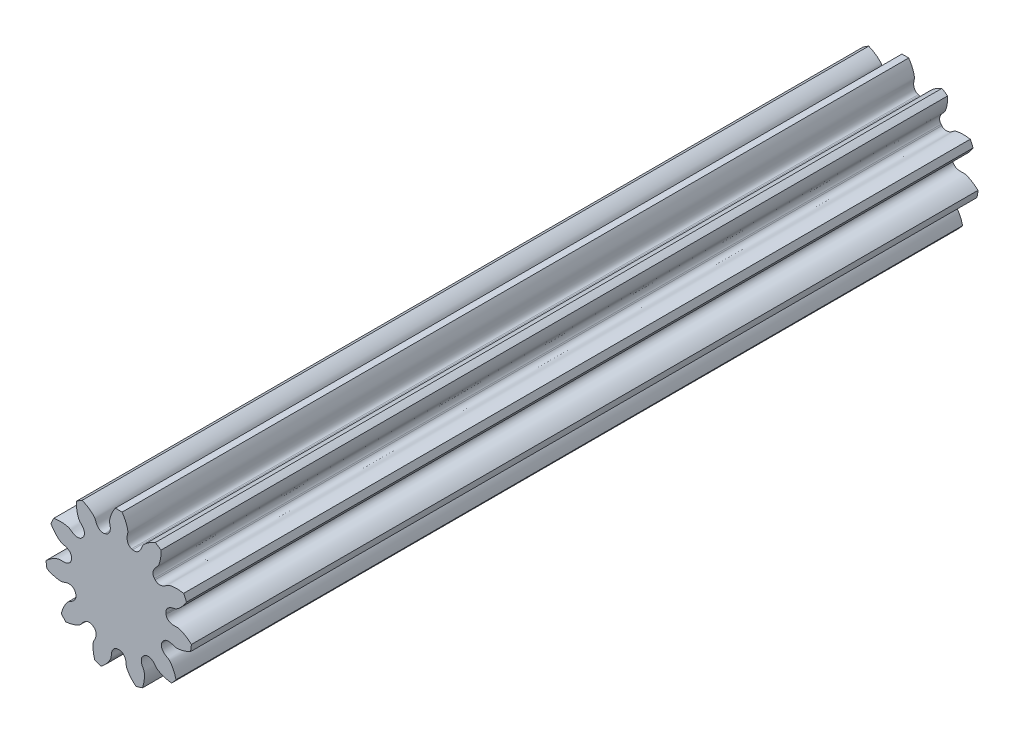
from build123d import *

# Parameters (mm, degrees)
EXTRUDE_1_DEPTH = 70


with BuildPart() as part:
    # Эскиз1 → Бобышка-Вытянуть1 (new body)
    with BuildSketch(Plane.XY):
        with BuildLine():
            ThreePointArc((0.303, 6.493), (0, 6.500066), (-0.303, 6.493))
            add(Edge.make_bspline(
                [(-0.303, 6.493), (-0.346584218, 6.42959541), (-0.414908989, 6.322872217), (-0.503832534, 6.171085791), (-0.571642486, 6.040604913), (-0.631254096, 5.909462755), (-0.68518257, 5.779105167), (-0.72964324, 5.648408312), (-0.767399302, 5.518328721), (-0.797951002, 5.37284466), (-0.827792109, 5.196066136), (-0.768218484, 4.972302757), (-0.736721493, 4.755594452), (-0.753966504, 4.568401559), (-0.785235089, 4.447093131), (-0.829023332, 4.351746005), (-0.87759341, 4.275547448), (-0.932758863, 4.214584459), (-1.017734715, 4.14379099), (-1.09368593, 4.106410336), (-1.15, 4.092)],
                knots=[0, 0, 0, 0, 0.085617132, 0.140969585, 0.1957209, 0.24916994, 0.301247193, 0.352628837, 0.402767547, 0.451734397, 0.518547692, 0.59904648, 0.705842174, 0.760987907, 0.80705749, 0.844573024, 0.877292442, 0.9072362, 0.935685939, 1, 1, 1, 1], degree=3))
            ThreePointArc((-1.15, 4.092), (-1.197511317, 4.07834901), (-1.244860662, 4.064146396))
            add(Edge.make_bspline(
                [(-3.255481007, 5.626073356), (-3.184536521, 5.596297428), (-3.069359152, 5.543455325), (-2.912489968, 5.463840156), (-2.784901317, 5.390733484), (-2.663852036, 5.31263815), (-2.548007884, 5.232130303), (-2.439945133, 5.146218365), (-2.337856377, 5.057200918), (-2.23350003, 4.951329433), (-2.112822407, 4.818747197), (-2.041963313, 4.59829753), (-1.951298913, 4.398962343), (-1.835587368, 4.250809018), (-1.743698272, 4.165662948), (-1.655312711, 4.109125552), (-1.573256911, 4.071282214), (-1.493889699, 4.04982158), (-1.384129623, 4.036207738), (-1.300025889, 4.045823457), (-1.244860662, 4.064146396)],
                knots=[0, 0, 0, 0, 0.085617132, 0.140969585, 0.1957209, 0.24916994, 0.301247193, 0.352628837, 0.402767547, 0.451734397, 0.518547692, 0.59904648, 0.705842174, 0.760987907, 0.80705749, 0.844573024, 0.877292442, 0.9072362, 0.935685939, 1, 1, 1, 1], degree=3))
            ThreePointArc((-3.255481007, 5.626073356), (-3.514200996, 5.468203486), (-3.765280648, 5.298445021))
            add(Edge.make_bspline(
                [(-3.765280648, 5.298445021), (-3.767666916, 5.221542278), (-3.767446457, 5.094821856), (-3.760191766, 4.91905529), (-3.746693839, 4.772626962), (-3.725941513, 4.630074689), (-3.700832399, 4.491254973), (-3.66757504, 4.357268529), (-3.629011125, 4.227426146), (-3.576058228, 4.08851967), (-3.50558848, 3.923670791), (-3.334496341, 3.767636991), (-3.190838031, 3.602358923), (-3.104141339, 3.435558884), (-3.064861858, 3.316602666), (-3.050150324, 3.212717849), (-3.049814024, 3.122356577), (-3.063263076, 3.041246552), (-3.096475473, 2.935749881), (-3.140160193, 2.863240947), (-3.179743788, 2.820672516)],
                knots=[0, 0, 0, 0, 0.085617132, 0.140969585, 0.1957209, 0.24916994, 0.301247193, 0.352628837, 0.402767547, 0.451734397, 0.518547692, 0.59904648, 0.705842174, 0.760987907, 0.80705749, 0.844573024, 0.877292442, 0.9072362, 0.935685939, 1, 1, 1, 1], degree=3))
            ThreePointArc((-3.179743788, 2.820672516), (-3.212332568, 2.783502015), (-3.24448686, 2.745955028))
            add(Edge.make_bspline(
                [(-5.780369797, 2.972908174), (-5.704589415, 2.986214554), (-5.579127449, 3.004030536), (-5.404117483, 3.021863877), (-5.257258629, 3.029342263), (-5.113203968, 3.029088471), (-4.972223838, 3.023991037), (-4.834868167, 3.010140449), (-4.700859174, 2.990447556), (-4.555830583, 2.957802096), (-4.382630738, 2.91151007), (-4.203836187, 2.764365327), (-4.019795702, 2.645690773), (-3.842355221, 2.583614649), (-3.719019753, 2.561664212), (-3.614098664, 2.561886771), (-3.524609278, 2.574413643), (-3.446238836, 2.599268963), (-3.346542586, 2.647157048), (-3.280988673, 2.700716217), (-3.24448686, 2.745955028)],
                knots=[0, 0, 0, 0, 0.085617132, 0.140969585, 0.1957209, 0.24916994, 0.301247193, 0.352628837, 0.402767547, 0.451734397, 0.518547692, 0.59904648, 0.705842174, 0.760987907, 0.80705749, 0.844573024, 0.877292442, 0.9072362, 0.935685939, 1, 1, 1, 1], degree=3))
            ThreePointArc((-5.780369797, 2.972908174), (-5.912668005, 2.700225002), (-6.032111295, 2.421671185))
            add(Edge.make_bspline(
                [(-6.032111295, 2.421671185), (-5.992541989, 2.355686367), (-5.923846295, 2.249201553), (-5.82271668, 2.105259491), (-5.732196371, 1.989373673), (-5.637668826, 1.880670624), (-5.541494091, 1.777463059), (-5.441077679, 1.682726776), (-5.338437556, 1.594345639), (-5.218792234, 1.506118572), (-5.070385277, 1.405537693), (-4.84209517, 1.366773102), (-4.631886039, 1.305399889), (-4.468773231, 1.211950537), (-4.371416643, 1.13311429), (-4.30287614, 1.053674476), (-4.253740234, 0.977839554), (-4.221202906, 0.902334353), (-4.192107146, 0.795628928), (-4.189655782, 0.711012789), (-4.19994139, 0.653801439)],
                knots=[0, 0, 0, 0, 0.085617132, 0.140969585, 0.1957209, 0.24916994, 0.301247193, 0.352628837, 0.402767547, 0.451734397, 0.518547692, 0.59904648, 0.705842174, 0.760987907, 0.80705749, 0.844573024, 0.877292442, 0.9072362, 0.935685939, 1, 1, 1, 1], degree=3))
            ThreePointArc((-4.19994139, 0.653801439), (-4.207260927, 0.604912798), (-4.214011404, 0.55594234))
            add(Edge.make_bspline(
                [(-6.470032018, -0.624134348), (-6.413475476, -0.571970341), (-6.317562201, -0.489152723), (-6.179975881, -0.379532831), (-6.060473472, -0.293843722), (-5.939149769, -0.216175396), (-5.817793856, -0.144244018), (-5.694754719, -0.081635791), (-5.571372399, -0.025751776), (-5.431717116, 0.025193492), (-5.260984775, 0.079889067), (-5.031020774, 0.052766665), (-4.812035757, 0.052431075), (-4.62920244, 0.096140883), (-4.513578739, 0.144355189), (-4.425433827, 0.201267041), (-4.356923104, 0.260186931), (-4.304431493, 0.323466817), (-4.246451924, 0.417652699), (-4.220260736, 0.498150661), (-4.214011404, 0.55594234)],
                knots=[0, 0, 0, 0, 0.085617132, 0.140969585, 0.1957209, 0.24916994, 0.301247193, 0.352628837, 0.402767547, 0.451734397, 0.518547692, 0.59904648, 0.705842174, 0.760987907, 0.80705749, 0.844573024, 0.877292442, 0.9072362, 0.935685939, 1, 1, 1, 1], degree=3))
            ThreePointArc((-6.470032018, -0.624134348), (-6.4339047, -0.925055842), (-6.383789226, -1.223966142))
            add(Edge.make_bspline(
                [(-6.383789226, -1.223966142), (-6.314827322, -1.258083321), (-6.199466789, -1.310524351), (-6.03657019, -1.376941321), (-5.897767057, -1.425491701), (-5.75947612, -1.465833076), (-5.622770562, -1.500660817), (-5.4870766, -1.526068839), (-5.352947784, -1.544928343), (-5.204596581, -1.55446453), (-5.025370575, -1.558843691), (-4.812362995, -1.468031591), (-4.602342957, -1.406014386), (-4.414601197, -1.396443541), (-4.29007753, -1.410129868), (-4.189469184, -1.439903098), (-4.107133975, -1.477134618), (-4.03894064, -1.523062628), (-3.956774421, -1.597098588), (-3.908965263, -1.666956907), (-3.886687276, -1.720646976)],
                knots=[0, 0, 0, 0, 0.085617132, 0.140969585, 0.1957209, 0.24916994, 0.301247193, 0.352628837, 0.402767547, 0.451734397, 0.518547692, 0.59904648, 0.705842174, 0.760987907, 0.80705749, 0.844573024, 0.877292442, 0.9072362, 0.935685939, 1, 1, 1, 1], degree=3))
            ThreePointArc((-3.886687276, -1.720646976), (-3.866413668, -1.765731958), (-3.845617102, -1.810578113))
            add(Edge.make_bspline(
                [(-5.105504789, -4.023018624), (-5.08612839, -3.948558694), (-5.050215592, -3.827033449), (-4.993735603, -3.660430547), (-4.939530809, -3.523736401), (-4.879457483, -3.392805102), (-4.816255431, -3.266682615), (-4.746596885, -3.147493244), (-4.673014252, -3.0337751), (-4.583071843, -2.915413868), (-4.469013319, -2.777096149), (-4.260891813, -2.67558504), (-4.07648846, -2.557475118), (-3.946310592, -2.421856933), (-3.875108367, -2.318785587), (-3.831725018, -2.223253553), (-3.805944628, -2.136647294), (-3.795997565, -2.055033759), (-3.798142779, -1.944453431), (-3.819629834, -1.862574211), (-3.845617102, -1.810578113)],
                knots=[0, 0, 0, 0, 0.085617132, 0.140969585, 0.1957209, 0.24916994, 0.301247193, 0.352628837, 0.402767547, 0.451734397, 0.518547692, 0.59904648, 0.705842174, 0.760987907, 0.80705749, 0.844573024, 0.877292442, 0.9072362, 0.935685939, 1, 1, 1, 1], degree=3))
            ThreePointArc((-5.105504789, -4.023018624), (-4.912422113, -4.256637991), (-4.708659184, -4.481002867))
            add(Edge.make_bspline(
                [(-4.708659184, -4.481002867), (-4.632199599, -4.472420444), (-4.506800382, -4.454168033), (-4.333855317, -4.421972993), (-4.190838374, -4.387773532), (-4.052690441, -4.346945132), (-3.918857109, -4.302335487), (-3.790967469, -4.250348381), (-3.667934912, -4.193698492), (-3.537978286, -4.121516127), (-3.384836222, -4.028303218), (-3.254739572, -3.836746626), (-3.111588505, -3.671029028), (-2.958824475, -3.561476663), (-2.846669114, -3.505667756), (-2.745935363, -3.476321613), (-2.656541699, -3.463128986), (-2.574343258, -3.464897986), (-2.465193774, -3.482758587), (-2.387205893, -3.515679562), (-2.339437414, -3.548802134)],
                knots=[0, 0, 0, 0, 0.085617132, 0.140969585, 0.1957209, 0.24916994, 0.301247193, 0.352628837, 0.402767547, 0.451734397, 0.518547692, 0.59904648, 0.705842174, 0.760987907, 0.80705749, 0.844573024, 0.877292442, 0.9072362, 0.935685939, 1, 1, 1, 1], degree=3))
            ThreePointArc((-2.339437414, -3.548802134), (-2.298007388, -3.575769294), (-2.256266542, -3.602252808))
            add(Edge.make_bspline(
                [(-2.120015863, -6.144622913), (-2.143971476, -6.071507561), (-2.179461216, -5.949858095), (-2.222019554, -5.779167428), (-2.250322015, -5.634867671), (-2.270571922, -5.492243161), (-2.285589937, -5.351972564), (-2.291428078, -5.214043831), (-2.291007098, -5.078596266), (-2.279333643, -4.930397924), (-2.258161711, -4.752372961), (-2.137959807, -4.554457401), (-2.04668488, -4.355401032), (-2.010493015, -4.170932286), (-2.006318469, -4.045728322), (-2.02147059, -3.941906852), (-2.046605625, -3.855111099), (-2.082361231, -3.781075636), (-2.143950139, -3.689209335), (-2.206293448, -3.631944931), (-2.256266542, -3.602252808)],
                knots=[0, 0, 0, 0, 0.085617132, 0.140969585, 0.1957209, 0.24916994, 0.301247193, 0.352628837, 0.402767547, 0.451734397, 0.518547692, 0.59904648, 0.705842174, 0.760987907, 0.80705749, 0.844573024, 0.877292442, 0.9072362, 0.935685939, 1, 1, 1, 1], degree=3))
            ThreePointArc((-2.120015863, -6.144622913), (-1.831280214, -6.236767655), (-1.538563121, -6.315352842))
            add(Edge.make_bspline(
                [(-1.538563121, -6.315352842), (-1.478881232, -6.266795677), (-1.383256697, -6.183644836), (-1.255172002, -6.063059484), (-1.153348118, -5.956968269), (-1.059204181, -5.847932822), (-0.970734213, -5.738049039), (-0.891252954, -5.625172343), (-0.818378622, -5.510999001), (-0.748076884, -5.380015475), (-0.669640285, -5.218804936), (-0.663759331, -4.987321716), (-0.632926688, -4.770517892), (-0.563641889, -4.595766108), (-0.499463367, -4.488180901), (-0.430586467, -4.409032577), (-0.362516204, -4.34960437), (-0.292410081, -4.306652715), (-0.190931522, -4.262667342), (-0.107525519, -4.248198797), (-0.049432703, -4.250237688)],
                knots=[0, 0, 0, 0, 0.085617132, 0.140969585, 0.1957209, 0.24916994, 0.301247193, 0.352628837, 0.402767547, 0.451734397, 0.518547692, 0.59904648, 0.705842174, 0.760987907, 0.80705749, 0.844573024, 0.877292442, 0.9072362, 0.935685939, 1, 1, 1, 1], degree=3))
            ThreePointArc((-0.049432703, -4.250237688), (0, -4.250525144), (0.049432703, -4.250237688))
            add(Edge.make_bspline(
                [(1.538563121, -6.315352842), (1.478881232, -6.266795677), (1.383256697, -6.183644836), (1.255172002, -6.063059484), (1.153348118, -5.956968269), (1.059204181, -5.847932822), (0.970734213, -5.738049039), (0.891252954, -5.625172343), (0.818378622, -5.510999001), (0.748076884, -5.380015475), (0.669640285, -5.218804936), (0.663759331, -4.987321716), (0.632926688, -4.770517892), (0.563641889, -4.595766108), (0.499463367, -4.488180901), (0.430586467, -4.409032577), (0.362516204, -4.34960437), (0.292410081, -4.306652715), (0.190931522, -4.262667342), (0.107525519, -4.248198797), (0.049432703, -4.250237688)],
                knots=[0, 0, 0, 0, 0.085617132, 0.140969585, 0.1957209, 0.24916994, 0.301247193, 0.352628837, 0.402767547, 0.451734397, 0.518547692, 0.59904648, 0.705842174, 0.760987907, 0.80705749, 0.844573024, 0.877292442, 0.9072362, 0.935685939, 1, 1, 1, 1], degree=3))
            ThreePointArc((1.538563121, -6.315352842), (1.831280214, -6.236767655), (2.120015863, -6.144622913))
            add(Edge.make_bspline(
                [(2.120015863, -6.144622913), (2.143971476, -6.071507561), (2.179461216, -5.949858095), (2.222019554, -5.779167428), (2.250322015, -5.634867671), (2.270571922, -5.492243161), (2.285589937, -5.351972564), (2.291428078, -5.214043831), (2.291007098, -5.078596266), (2.279333643, -4.930397924), (2.258161711, -4.752372961), (2.137959807, -4.554457401), (2.04668488, -4.355401032), (2.010493015, -4.170932286), (2.006318469, -4.045728322), (2.02147059, -3.941906852), (2.046605625, -3.855111099), (2.082361231, -3.781075636), (2.143950139, -3.689209335), (2.206293448, -3.631944931), (2.256266542, -3.602252808)],
                knots=[0, 0, 0, 0, 0.085617132, 0.140969585, 0.1957209, 0.24916994, 0.301247193, 0.352628837, 0.402767547, 0.451734397, 0.518547692, 0.59904648, 0.705842174, 0.760987907, 0.80705749, 0.844573024, 0.877292442, 0.9072362, 0.935685939, 1, 1, 1, 1], degree=3))
            ThreePointArc((2.256266542, -3.602252808), (2.298007388, -3.575769294), (2.339437414, -3.548802134))
            add(Edge.make_bspline(
                [(4.708659184, -4.481002867), (4.632199599, -4.472420444), (4.506800382, -4.454168033), (4.333855317, -4.421972993), (4.190838374, -4.387773532), (4.052690441, -4.346945132), (3.918857109, -4.302335487), (3.790967469, -4.250348381), (3.667934912, -4.193698492), (3.537978286, -4.121516127), (3.384836222, -4.028303218), (3.254739572, -3.836746626), (3.111588505, -3.671029028), (2.958824475, -3.561476663), (2.846669114, -3.505667756), (2.745935363, -3.476321613), (2.656541699, -3.463128986), (2.574343258, -3.464897986), (2.465193774, -3.482758587), (2.387205893, -3.515679562), (2.339437414, -3.548802134)],
                knots=[0, 0, 0, 0, 0.085617132, 0.140969585, 0.1957209, 0.24916994, 0.301247193, 0.352628837, 0.402767547, 0.451734397, 0.518547692, 0.59904648, 0.705842174, 0.760987907, 0.80705749, 0.844573024, 0.877292442, 0.9072362, 0.935685939, 1, 1, 1, 1], degree=3))
            ThreePointArc((4.708659184, -4.481002867), (4.912422113, -4.256637991), (5.105504789, -4.023018624))
            add(Edge.make_bspline(
                [(5.105504789, -4.023018624), (5.08612839, -3.948558694), (5.050215592, -3.827033449), (4.993735603, -3.660430547), (4.939530809, -3.523736401), (4.879457483, -3.392805102), (4.816255431, -3.266682615), (4.746596885, -3.147493244), (4.673014252, -3.0337751), (4.583071843, -2.915413868), (4.469013319, -2.777096149), (4.260891813, -2.67558504), (4.07648846, -2.557475118), (3.946310592, -2.421856933), (3.875108367, -2.318785587), (3.831725018, -2.223253553), (3.805944628, -2.136647294), (3.795997565, -2.055033759), (3.798142779, -1.944453431), (3.819629834, -1.862574211), (3.845617102, -1.810578113)],
                knots=[0, 0, 0, 0, 0.085617132, 0.140969585, 0.1957209, 0.24916994, 0.301247193, 0.352628837, 0.402767547, 0.451734397, 0.518547692, 0.59904648, 0.705842174, 0.760987907, 0.80705749, 0.844573024, 0.877292442, 0.9072362, 0.935685939, 1, 1, 1, 1], degree=3))
            ThreePointArc((3.845617102, -1.810578113), (3.866413668, -1.765731958), (3.886687276, -1.720646976))
            add(Edge.make_bspline(
                [(6.383789226, -1.223966142), (6.314827322, -1.258083321), (6.199466789, -1.310524351), (6.03657019, -1.376941321), (5.897767057, -1.425491701), (5.75947612, -1.465833076), (5.622770562, -1.500660817), (5.4870766, -1.526068839), (5.352947784, -1.544928343), (5.204596581, -1.55446453), (5.025370575, -1.558843691), (4.812362995, -1.468031591), (4.602342957, -1.406014386), (4.414601197, -1.396443541), (4.29007753, -1.410129868), (4.189469184, -1.439903098), (4.107133975, -1.477134618), (4.03894064, -1.523062628), (3.956774421, -1.597098588), (3.908965263, -1.666956907), (3.886687276, -1.720646976)],
                knots=[0, 0, 0, 0, 0.085617132, 0.140969585, 0.1957209, 0.24916994, 0.301247193, 0.352628837, 0.402767547, 0.451734397, 0.518547692, 0.59904648, 0.705842174, 0.760987907, 0.80705749, 0.844573024, 0.877292442, 0.9072362, 0.935685939, 1, 1, 1, 1], degree=3))
            ThreePointArc((6.383789226, -1.223966142), (6.4339047, -0.925055842), (6.470032018, -0.624134348))
            add(Edge.make_bspline(
                [(6.470032018, -0.624134348), (6.413475476, -0.571970341), (6.317562201, -0.489152723), (6.179975881, -0.379532831), (6.060473472, -0.293843722), (5.939149769, -0.216175396), (5.817793856, -0.144244018), (5.694754719, -0.081635791), (5.571372399, -0.025751776), (5.431717116, 0.025193492), (5.260984775, 0.079889067), (5.031020774, 0.052766665), (4.812035757, 0.052431075), (4.62920244, 0.096140883), (4.513578739, 0.144355189), (4.425433827, 0.201267041), (4.356923104, 0.260186931), (4.304431493, 0.323466817), (4.246451924, 0.417652699), (4.220260736, 0.498150661), (4.214011404, 0.55594234)],
                knots=[0, 0, 0, 0, 0.085617132, 0.140969585, 0.1957209, 0.24916994, 0.301247193, 0.352628837, 0.402767547, 0.451734397, 0.518547692, 0.59904648, 0.705842174, 0.760987907, 0.80705749, 0.844573024, 0.877292442, 0.9072362, 0.935685939, 1, 1, 1, 1], degree=3))
            ThreePointArc((4.214011404, 0.55594234), (4.207260927, 0.604912798), (4.19994139, 0.653801439))
            add(Edge.make_bspline(
                [(6.032111295, 2.421671185), (5.992541989, 2.355686367), (5.923846295, 2.249201553), (5.82271668, 2.105259491), (5.732196371, 1.989373673), (5.637668826, 1.880670624), (5.541494091, 1.777463059), (5.441077679, 1.682726776), (5.338437556, 1.594345639), (5.218792234, 1.506118572), (5.070385277, 1.405537693), (4.84209517, 1.366773102), (4.631886039, 1.305399889), (4.468773231, 1.211950537), (4.371416643, 1.13311429), (4.30287614, 1.053674476), (4.253740234, 0.977839554), (4.221202906, 0.902334353), (4.192107146, 0.795628928), (4.189655782, 0.711012789), (4.19994139, 0.653801439)],
                knots=[0, 0, 0, 0, 0.085617132, 0.140969585, 0.1957209, 0.24916994, 0.301247193, 0.352628837, 0.402767547, 0.451734397, 0.518547692, 0.59904648, 0.705842174, 0.760987907, 0.80705749, 0.844573024, 0.877292442, 0.9072362, 0.935685939, 1, 1, 1, 1], degree=3))
            ThreePointArc((6.032111295, 2.421671185), (5.912668005, 2.700225002), (5.780369797, 2.972908174))
            add(Edge.make_bspline(
                [(5.780369797, 2.972908174), (5.704589415, 2.986214554), (5.579127449, 3.004030536), (5.404117483, 3.021863877), (5.257258629, 3.029342263), (5.113203968, 3.029088471), (4.972223838, 3.023991037), (4.834868167, 3.010140449), (4.700859174, 2.990447556), (4.555830583, 2.957802096), (4.382630738, 2.91151007), (4.203836187, 2.764365327), (4.019795702, 2.645690773), (3.842355221, 2.583614649), (3.719019753, 2.561664212), (3.614098664, 2.561886771), (3.524609278, 2.574413643), (3.446238836, 2.599268963), (3.346542586, 2.647157048), (3.280988673, 2.700716217), (3.24448686, 2.745955028)],
                knots=[0, 0, 0, 0, 0.085617132, 0.140969585, 0.1957209, 0.24916994, 0.301247193, 0.352628837, 0.402767547, 0.451734397, 0.518547692, 0.59904648, 0.705842174, 0.760987907, 0.80705749, 0.844573024, 0.877292442, 0.9072362, 0.935685939, 1, 1, 1, 1], degree=3))
            ThreePointArc((3.24448686, 2.745955028), (3.212332568, 2.783502015), (3.179743788, 2.820672516))
            add(Edge.make_bspline(
                [(3.765280648, 5.298445021), (3.767666916, 5.221542278), (3.767446457, 5.094821856), (3.760191766, 4.91905529), (3.746693839, 4.772626962), (3.725941513, 4.630074689), (3.700832399, 4.491254973), (3.66757504, 4.357268529), (3.629011125, 4.227426146), (3.576058228, 4.08851967), (3.50558848, 3.923670791), (3.334496341, 3.767636991), (3.190838031, 3.602358923), (3.104141339, 3.435558884), (3.064861858, 3.316602666), (3.050150324, 3.212717849), (3.049814024, 3.122356577), (3.063263076, 3.041246552), (3.096475473, 2.935749881), (3.140160193, 2.863240947), (3.179743788, 2.820672516)],
                knots=[0, 0, 0, 0, 0.085617132, 0.140969585, 0.1957209, 0.24916994, 0.301247193, 0.352628837, 0.402767547, 0.451734397, 0.518547692, 0.59904648, 0.705842174, 0.760987907, 0.80705749, 0.844573024, 0.877292442, 0.9072362, 0.935685939, 1, 1, 1, 1], degree=3))
            ThreePointArc((3.765280648, 5.298445021), (3.514200996, 5.468203486), (3.255481007, 5.626073356))
            add(Edge.make_bspline(
                [(3.255481007, 5.626073356), (3.184536521, 5.596297428), (3.069359152, 5.543455325), (2.912489968, 5.463840156), (2.784901317, 5.390733484), (2.663852036, 5.31263815), (2.548007884, 5.232130303), (2.439945133, 5.146218365), (2.337856377, 5.057200918), (2.23350003, 4.951329433), (2.112822407, 4.818747197), (2.041963313, 4.59829753), (1.951298913, 4.398962343), (1.835587368, 4.250809018), (1.743698272, 4.165662948), (1.655312711, 4.109125552), (1.573256911, 4.071282214), (1.493889699, 4.04982158), (1.384129623, 4.036207738), (1.300025889, 4.045823457), (1.244860662, 4.064146396)],
                knots=[0, 0, 0, 0, 0.085617132, 0.140969585, 0.1957209, 0.24916994, 0.301247193, 0.352628837, 0.402767547, 0.451734397, 0.518547692, 0.59904648, 0.705842174, 0.760987907, 0.80705749, 0.844573024, 0.877292442, 0.9072362, 0.935685939, 1, 1, 1, 1], degree=3))
            ThreePointArc((1.244860662, 4.064146396), (1.197511317, 4.07834901), (1.15, 4.092))
            add(Edge.make_bspline(
                [(0.303, 6.493), (0.346584218, 6.42959541), (0.414908989, 6.322872217), (0.503832534, 6.171085791), (0.571642486, 6.040604913), (0.631254096, 5.909462755), (0.68518257, 5.779105167), (0.72964324, 5.648408312), (0.767399302, 5.518328721), (0.797951002, 5.37284466), (0.827792109, 5.196066136), (0.768218484, 4.972302757), (0.736721493, 4.755594452), (0.753966504, 4.568401559), (0.785235089, 4.447093131), (0.829023332, 4.351746005), (0.87759341, 4.275547448), (0.932758863, 4.214584459), (1.017734715, 4.14379099), (1.09368593, 4.106410336), (1.15, 4.092)],
                knots=[0, 0, 0, 0, 0.085617132, 0.140969585, 0.1957209, 0.24916994, 0.301247193, 0.352628837, 0.402767547, 0.451734397, 0.518547692, 0.59904648, 0.705842174, 0.760987907, 0.80705749, 0.844573024, 0.877292442, 0.9072362, 0.935685939, 1, 1, 1, 1], degree=3))
        make_face()
    extrude(amount=EXTRUDE_1_DEPTH)


solid = part.part
